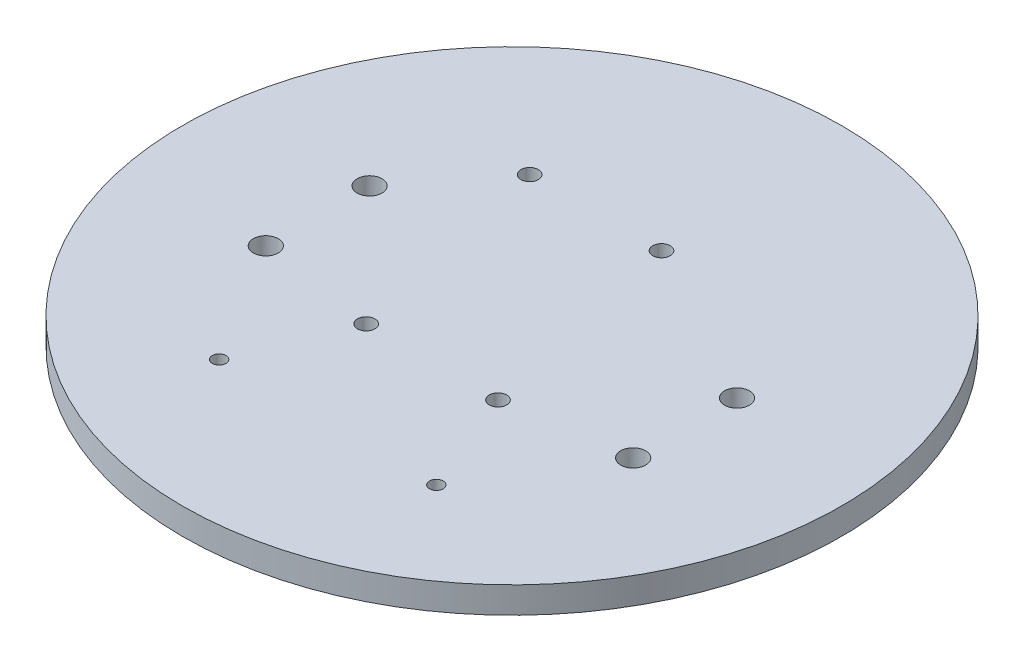
from build123d import *

# Parameters (mm, degrees)
SKETCH1_R                   = 79.375
BOSS_EXTRUDE1_DEPTH         = 3.175
TAP_DRILL_FOR_M5X0_8_TAP1_D = 4.2
TAP_DRILL_FOR_M7X1_0_TAP1_D = 6
TAP_DRILL_FOR_M4X0_7_TAP1_D = 3.3


with BuildPart() as part:
    # Sketch1 → Boss-Extrude1 (new, symmetric)
    with BuildSketch(Plane(origin=(0, 0, 0), x_dir=(1, 0, 0), z_dir=(0, 1, 0))):
        Circle(SKETCH1_R)
    extrude(amount=BOSS_EXTRUDE1_DEPTH, both=True)

    # Tap Drill for M5x0.8 Tap1 (through all)
    with Locations(Plane(origin=(0, 3.175, 0), x_dir=(1, 0, 0), z_dir=(0, 1, 0))):
        with Locations((-27.3188086, 31.571183672), (4.4311914, 31.571183672), (-15.875, -19.245910728), (15.875, -19.245910728)):
            Hole(TAP_DRILL_FOR_M5X0_8_TAP1_D / 2)

    # Tap Drill for M7x1.0 Tap1 (through all)
    with Locations(Plane(origin=(0, 3.175, 0), x_dir=(1, 0, 0), z_dir=(0, 1, 0))):
        with Locations((-44.245, 9.941583672), (-44.245, -15.058416328), (44.245, 9.941583672), (44.245, -15.058416328)):
            Hole(TAP_DRILL_FOR_M7X1_0_TAP1_D / 2)

    # Tap Drill for M4x0.7 Tap1 (through all)
    with Locations(Plane(origin=(0, 3.175, 0), x_dir=(1, 0, 0), z_dir=(0, 1, 0))):
        with Locations((-26.155, -44.384416328), (26.155, -44.384416328)):
            Hole(TAP_DRILL_FOR_M4X0_7_TAP1_D / 2)


solid = part.part
